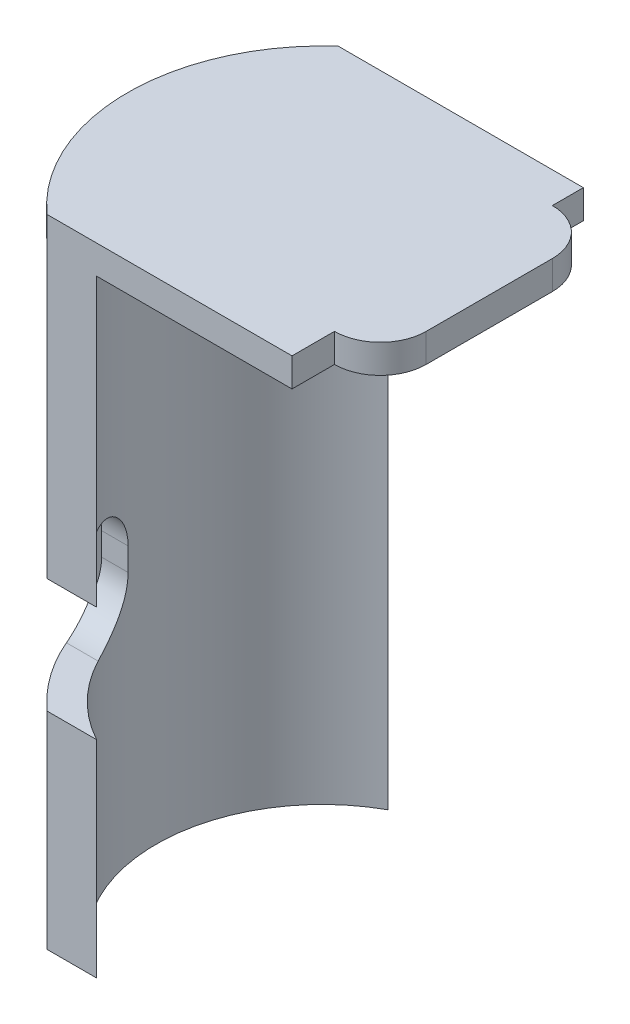
from build123d import *

# Parameters (mm, degrees)
BOSS_EXTRUDE1_DEPTH = 53
BOSS_EXTRUDE2_DEPTH = 2.5
SKETCH3_W           = 19
SKETCH3_H           = 2.5
BOSS_EXTRUDE3_DEPTH = 4
SKETCH4_W           = 9.555688256
SKETCH4_H           = 10
CUT_EXTRUDE1_DEPTH  = 10
FILLET2_R           = 4
FILLET3_R           = 4


with BuildPart() as part:
    # Sketch1 → Boss-Extrude1 (new body)
    with BuildSketch(Plane(origin=(0, 0, 0), x_dir=(1, 0, 0), z_dir=(0, 1, 0))):
        with BuildLine():
            Line((-6.997142274, 12.7), (-11.313185358, 12.7))
            Line((-11.313185358, 12.7), (-11.695935453, 12.337142857))
            ThreePointArc((-11.695935453, 12.337142857), (-17, 0), (-11.695935453, -12.337142857))
            Line((-11.695935453, -12.337142857), (-11.313185358, -12.7))
            Line((-11.313185358, -12.7), (-6.997142274, -12.7))
            ThreePointArc((-6.997142274, -12.7), (-14.5, 0), (-6.997142274, 12.7))
        make_face()
    extrude(amount=BOSS_EXTRUDE1_DEPTH)

    # Sketch2 → Boss-Extrude2 (add)
    with BuildSketch(Plane(origin=(0, 53, 0), x_dir=(1, 0, 0), z_dir=(0, 1, 0))):
        with BuildLine():
            Line((10.046814642, 12.7), (10.046814642, -12.7))
            Line((10.046814642, -12.7), (-11.313185358, -12.7))
            ThreePointArc((-11.313185358, -12.7), (-17, 0), (-11.313185358, 12.7))
            Line((-11.313185358, 12.7), (10.046814642, 12.7))
        make_face()
    extrude(amount=BOSS_EXTRUDE2_DEPTH)

    # Sketch3 → Boss-Extrude3 (add)
    with BuildSketch(Plane(origin=(10.046814642, 0, 0), x_dir=(0, 0, -1), z_dir=(1, 0, 0))):
        with Locations((0.5, 54.25)):
            Rectangle(SKETCH3_W, SKETCH3_H)
    extrude(amount=BOSS_EXTRUDE3_DEPTH)

    # Sketch4 → Cut-Extrude1 (cut)
    with BuildSketch(Plane.XY.offset(12.7)):
        with Locations((-11.774986402, 23)):
            Rectangle(SKETCH4_W, SKETCH4_H)
    extrude(amount=-CUT_EXTRUDE1_DEPTH, mode=Mode.SUBTRACT)

    # Fillet2
    fillet2_edges = [part.edges().sort_by_distance(p)[0] for p in [
        (14.046814642, 54.25, -10),
        (14.046814642, 54.25, 9),
    ]]
    fillet(fillet2_edges, radius=FILLET2_R - 0.0001)  # a hair under: the kernel refuses the full size

    # Fillet3
    fillet3_edges = [part.edges().sort_by_distance(p)[0] for p in [
        (-15.399616792, 18, 2.7),
        (-15.399616792, 28, 2.7),
    ]]
    fillet(fillet3_edges, radius=FILLET3_R)


solid = part.part
